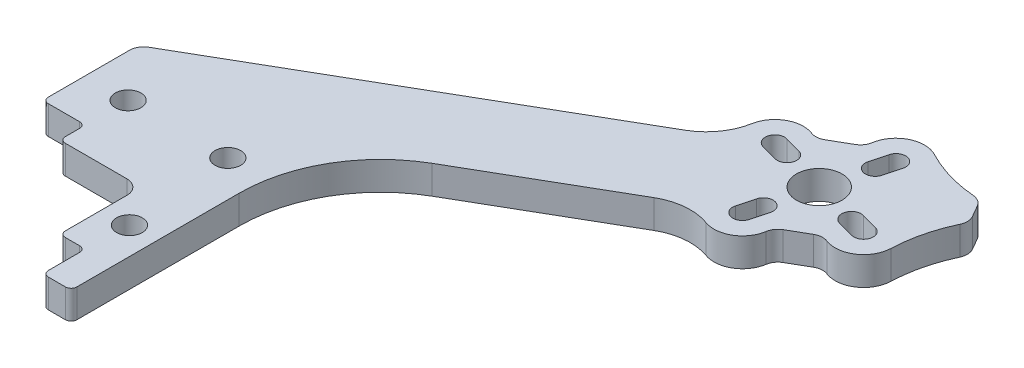
from build123d import *

# Parameters (mm, degrees)
SKETCH1_R            = 4
BOSS_EXTRUDE1_DEPTH  = 2.5
FILLET1_R            = 2.5
FILLET2_R            = 1
M4_CLEARANCE_HOLE1_D = 4.5


with BuildPart() as part:
    # Sketch1 → Boss-Extrude1 (new, symmetric)
    with BuildSketch(Plane(origin=(0, 0, 0), x_dir=(1, 0, 0), z_dir=(0, 1, 0))):
        with BuildLine():
            Line((26.35, 0), (31.35, 0))
            Line((31.35, 0), (31.35, 29.5))
            ThreePointArc((31.35, 29.5), (34.670276549, 41.891440775), (43.741440775, 50.962605002))
            Line((43.741440775, 50.962605002), (68.43853006, 65.221476148))
            ThreePointArc((68.43853006, 65.221476148), (72.532192535, 66.52006503), (76.79302358, 65.981804535))
            ThreePointArc((76.79302358, 65.981804535), (81.022280838, 66.392416408), (83.408453752, 69.908294377))
            ThreePointArc((83.408453752, 69.908294377), (83.817463572, 70.932749092), (84.627545458, 71.681457201))
            Line((84.627545458, 71.681457201), (88.007014214, 73.632594397))
            ThreePointArc((88.007014214, 73.632594397), (89.0604554, 73.959791835), (90.152164118, 73.801777372))
            ThreePointArc((90.152164118, 73.801777372), (94.697037231, 74.297462424), (96.938913491, 78.281877828))
            ThreePointArc((96.938913491, 78.281877828), (97.793206064, 83.885278146), (99.887787912, 89.152216327))
            Line((99.887787912, 89.152216327), (97.387787912, 93.482343346))
            ThreePointArc((97.387787912, 93.482343346), (91.779194723, 94.301851346), (86.499361414, 96.363712434))
            ThreePointArc((86.499361414, 96.363712434), (81.927818325, 96.414398343), (79.226105921, 92.726265296))
            ThreePointArc((79.226105921, 92.726265296), (78.817096101, 91.701810581), (78.007014214, 90.953102472))
            Line((78.007014214, 90.953102472), (74.627545458, 89.001965276))
            ThreePointArc((74.627545458, 89.001965276), (73.574104273, 88.674767838), (72.482395555, 88.832782301))
            ThreePointArc((72.482395555, 88.832782301), (68.24446946, 88.524234924), (65.774240518, 85.066896636))
            ThreePointArc((65.774240518, 85.066896636), (64.109972258, 81.107778463), (60.93853006, 78.211857205))
            Line((60.93853006, 78.211857205), (0, 43.028980471))
            Line((0, 43.028980471), (0, 26.35))
            Line((0, 26.35), (7.5, 26.35))
            Line((7.5, 26.35), (7.5, 21.825))
            Line((7.5, 21.825), (21.825, 21.825))
            Line((21.825, 21.825), (21.825, 7.5))
            Line((21.825, 7.5), (26.35, 7.5))
            Line((26.35, 7.5), (26.35, 0))
        make_face()
        with BuildLine():
            ThreePointArc((77.604653571, 74.029865603), (79.686719852, 75.231947131), (80.88880138, 73.149880849))
            Line((80.88880138, 73.149880849), (80.112344245, 70.252103371))
            ThreePointArc((80.112344245, 70.252103371), (78.030277964, 69.050021843), (76.828196436, 71.132088124))
            Line((76.828196436, 71.132088124), (77.604653571, 74.029865603))
        make_face(mode=Mode.SUBTRACT)
        with BuildLine():
            ThreePointArc((74.029865603, 85.029906102), (75.231947131, 82.947839821), (73.149880849, 81.745758293))
            Line((73.149880849, 81.745758293), (70.252103371, 82.522215428))
            ThreePointArc((70.252103371, 82.522215428), (69.050021843, 84.604281709), (71.132088124, 85.806363237))
            Line((71.132088124, 85.806363237), (74.029865603, 85.029906102))
        make_face(mode=Mode.SUBTRACT)
        with Locations((81.317279836, 81.317279836)):
            Circle(SKETCH1_R, mode=Mode.SUBTRACT)
        with BuildLine():
            ThreePointArc((88.60469407, 77.604653571), (87.402612542, 79.686719852), (89.484678823, 80.88880138))
            Line((89.484678823, 80.88880138), (92.382456302, 80.112344245))
            ThreePointArc((92.382456302, 80.112344245), (93.58453783, 78.030277964), (91.502471549, 76.828196436))
            Line((91.502471549, 76.828196436), (88.60469407, 77.604653571))
        make_face(mode=Mode.SUBTRACT)
        with BuildLine():
            ThreePointArc((85.029906102, 88.60469407), (82.947839821, 87.402612542), (81.745758293, 89.484678823))
            Line((81.745758293, 89.484678823), (82.522215428, 92.382456302))
            ThreePointArc((82.522215428, 92.382456302), (84.604281709, 93.58453783), (85.806363237, 91.502471549))
            Line((85.806363237, 91.502471549), (85.029906102, 88.60469407))
        make_face(mode=Mode.SUBTRACT)
    extrude(amount=BOSS_EXTRUDE1_DEPTH, both=True)

    # Fillet1
    fillet1_edges = [part.edges().sort_by_distance(p)[0] for p in [
        (99.887787912, 0, -89.152216327),
        (97.387787912, 0, -93.482343346),
        (0, 0, -43.028980471),
        (21.825, 0, -21.825),
    ]]
    fillet(fillet1_edges, radius=FILLET1_R)

    # Fillet2
    fillet2_edges = [part.edges().sort_by_distance(p)[0] for p in [
        (26.35, 0, 0),
        (26.35, 0, -7.5),
        (21.825, 0, -7.5),
        (0, 0, -26.35),
        (7.5, 0, -21.825),
        (7.5, 0, -26.35),
        (31.35, 0, 0),
    ]]
    fillet(fillet2_edges, radius=FILLET2_R)

    # M4 Clearance Hole1 (through all)
    with Locations(Plane(origin=(0, 2.5, 0), x_dir=(1, 0, 0), z_dir=(0, 1, 0))):
        with Locations((26.5875, 15), (7.5, 33.85), (25, 33.85)):
            Hole(M4_CLEARANCE_HOLE1_D / 2)


solid = part.part
